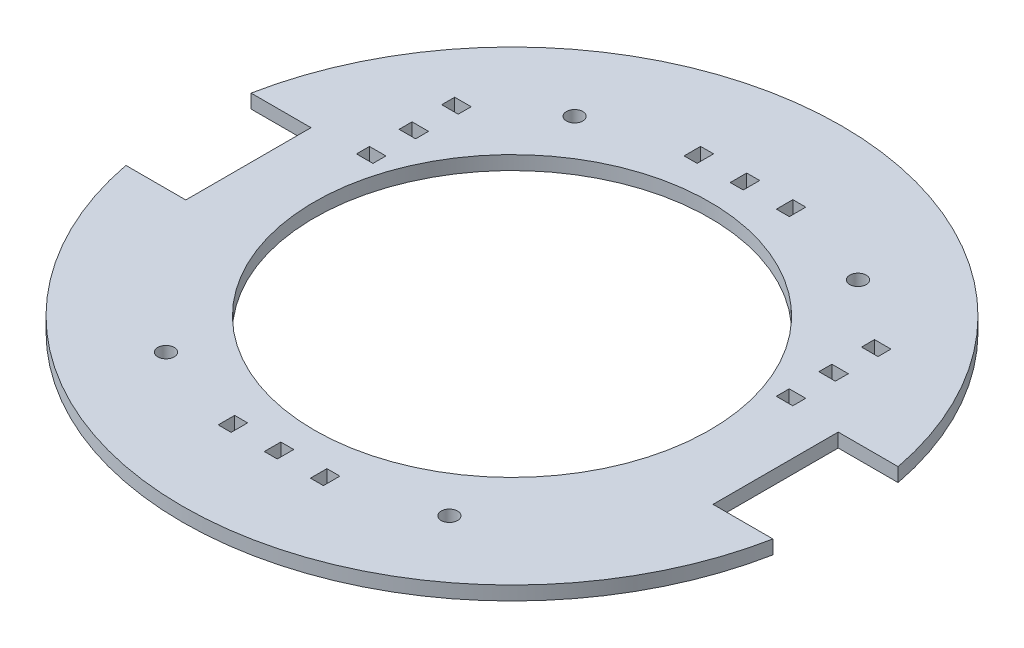
from build123d import *

# Parameters (mm, degrees)
SKETCH1_R          = 127
BASE_DEPTH         = 5.334
SKETCH2_R          = 76.2
CENTER_CUT_DEPTH   = 180.684310823
SKETCH14_W         = 5
SKETCH14_H         = 6.35
SKETCH14_W_2       = 6.35
SKETCH14_H_2       = 5
CUT_EXTRUDE1_DEPTH = 180.684310823
SKETCH15_W         = 30.48
SKETCH15_H         = 48.26
CUT_EXTRUDE2_DEPTH = 180.684310823
HOLE1_OUTLINE_R    = 3.175
HOLE1_DEPTH        = 5.334


# Read off the part's stored shape, not the designer's step: Hole1
with BuildPart() as part:
    # Sketch1 → Base (new body)
    with BuildSketch(Plane(origin=(0, 0, 0), x_dir=(1, 0, 0), z_dir=(0, 1, 0))):
        with Locations(Location((0, 0, 0), (0, 0, 270))):
            Circle(SKETCH1_R)
    extrude(amount=BASE_DEPTH)

    # Sketch2 → Center Cut (cut, through all)
    with BuildSketch(Plane(origin=(0, 5.334, 0), x_dir=(1, 0, 0), z_dir=(0, 1, 0))):
        with Locations(Location((0, 0, 0), (0, 0, 270))):
            Circle(SKETCH2_R)
    extrude(amount=-CENTER_CUT_DEPTH, mode=Mode.SUBTRACT)

    # Sketch14 → Cut-Extrude1 (cut, through all)
    with BuildSketch(Plane.XZ):
        with Locations((0, 89.789)):
            Rectangle(SKETCH14_W, SKETCH14_H)
        with Locations((-17.78, 89.789)):
            Rectangle(SKETCH14_W, SKETCH14_H)
        with Locations((17.78, 89.789)):
            Rectangle(SKETCH14_W, SKETCH14_H)
        with Locations((-80.899, -26.63)):
            Rectangle(SKETCH14_W_2, SKETCH14_H_2)
        with Locations((-80.899, -43.06)):
            Rectangle(SKETCH14_W_2, SKETCH14_H_2)
        with Locations((-80.899, -59.49)):
            Rectangle(SKETCH14_W_2, SKETCH14_H_2)
        with Locations((80.899, -26.63)):
            Rectangle(SKETCH14_W_2, SKETCH14_H_2)
        with Locations((80.899, -43.06)):
            Rectangle(SKETCH14_W_2, SKETCH14_H_2)
        with Locations((80.899, -59.49)):
            Rectangle(SKETCH14_W_2, SKETCH14_H_2)
        with Locations((17.78, -89.789)):
            Rectangle(SKETCH14_W, SKETCH14_H)
        with Locations((0, -89.789)):
            Rectangle(SKETCH14_W, SKETCH14_H)
        with Locations((-17.78, -89.789)):
            Rectangle(SKETCH14_W, SKETCH14_H)
    extrude(amount=-CUT_EXTRUDE1_DEPTH, mode=Mode.SUBTRACT)

    # Sketch15 → Cut-Extrude2 (cut, through all)
    with BuildSketch(Plane.XZ):
        with Locations((-116.84, 0)):
            Rectangle(SKETCH15_W, SKETCH15_H)
        with Locations((116.84, 0)):
            Rectangle(SKETCH15_W, SKETCH15_H)
    extrude(amount=-CUT_EXTRUDE2_DEPTH, mode=Mode.SUBTRACT)

    # Hole1 outline → Hole1 (cut)
    with BuildSketch(Plane(origin=(0, 0, 0), x_dir=(1, 0, 0), z_dir=(0, 1, 0))):
        with Locations((-54.61, -78.74)):
            Circle(HOLE1_OUTLINE_R)
        with Locations((54.61, -78.74)):
            Circle(HOLE1_OUTLINE_R)
        with Locations((54.61, 78.74)):
            Circle(HOLE1_OUTLINE_R)
        with Locations((-54.61, 78.74)):
            Circle(HOLE1_OUTLINE_R)
    extrude(amount=HOLE1_DEPTH, mode=Mode.SUBTRACT)


solid = part.part
